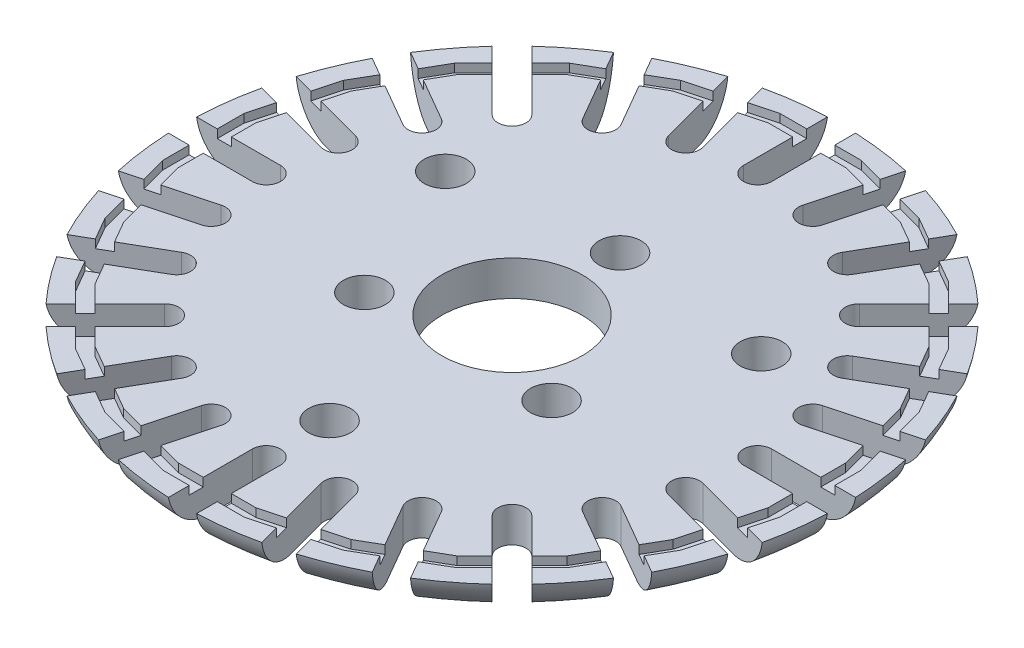
from build123d import *

# Parameters (mm, degrees)
ESBO_O1_R                = 23.5
RESSALTO_EXTRUS_O1_DEPTH = 2.5
FILETE1_R                = 3
CORTE_EXTRUS_O1_DEPTH    = 34.327916234
PADR_OCIRCULAR1_COUNT    = 24
CORTE_EXTRUS_O2_DEPTH    = 0.6
PADR_OCIRCULAR2_COUNT    = 24
ESBO_O5_R                = 5
CORTE_EXTRUS_O3_DEPTH    = 34.29789798
ESBO_O6_R                = 1.5
CORTE_EXTRUS_O5_DEPTH    = 2.5


with BuildPart() as part:
    # Esboço1 → Ressalto-extrusão1 (new body)
    with BuildSketch(Plane(origin=(0, 0, 0), x_dir=(1, 0, 0), z_dir=(0, 1, 0))):
        with Locations(Location((0, 0, 0), (0, 0, 270))):
            Circle(ESBO_O1_R)
    extrude(amount=RESSALTO_EXTRUS_O1_DEPTH)

    # Filete1
    # the kernel refuses this fillet: 3 mm, written as the material it takes off along each edge
    with BuildSketch(Plane(origin=(0, 0, 0), x_dir=(0, 0, 1), z_dir=(-1, 0, 0))) as filete1_piece_1:
        with BuildLine():
            CenterArc((20.541960108, 3), FILETE1_R, 270, 80.405931773)
            Line((20.541960108, 0), (20.541960108, -0.06))
            Line((20.541960108, -0.06), (23.5, -0.06))
            Line((23.5, -0.06), (23.56, 0))
            ThreePointArc((23.56, 0), (23.56, 1.25), (23.559160798, 2.49))
            Line((23.559160798, 2.49), (23.5, 2.5))
        make_face()
    revolve(axis=Axis((0, 0, 0), (0, 1, 0)), mode=Mode.SUBTRACT)

    # Esboço2 → Corte-extrusão1 (cut, through all)
    with BuildSketch(Plane(origin=(0, 2.5, 0), x_dir=(1, 0, 0), z_dir=(0, 1, 0))):
        with BuildLine():
            Line((1, 17.5), (1, 23.5))
            Line((1, 23.5), (-1, 23.5))
            Line((-1, 23.5), (-1, 17.5))
            ThreePointArc((-1, 17.5), (0, 16.5), (1, 17.5))
        make_face()
    corte_extrus_o1 = extrude(amount=-CORTE_EXTRUS_O1_DEPTH, mode=Mode.SUBTRACT)

    # PadrãoCircular1: Corte-extrusão1 ×24 about axis
    padr_ocircular1_axis = Axis((0, 0, 0), (0, 1, 0))
    for i in range(1, PADR_OCIRCULAR1_COUNT):
        add(corte_extrus_o1.rotate(padr_ocircular1_axis, i * 360 / PADR_OCIRCULAR1_COUNT), mode=Mode.SUBTRACT)

    # Esboço4 → Corte-extrusão2 (cut)
    with BuildSketch(Plane(origin=(0, 2.5, 0), x_dir=(1, 0, 0), z_dir=(0, 1, 0))):
        Polygon((-2.896354947, 22), (2.896354947, 22), (2.764702449, 21), (-2.764702449, 21), align=None)
    corte_extrus_o2 = extrude(amount=-CORTE_EXTRUS_O2_DEPTH, mode=Mode.SUBTRACT)

    # PadrãoCircular2: Corte-extrusão2 ×24 about axis
    padr_ocircular2_axis = Axis((0, 0, 0), (0, 1, 0))
    for i in range(1, PADR_OCIRCULAR2_COUNT):
        add(corte_extrus_o2.rotate(padr_ocircular2_axis, i * 360 / PADR_OCIRCULAR2_COUNT), mode=Mode.SUBTRACT)

    # Esboço5 → Corte-extrusão3 (cut, through all)
    with BuildSketch(Plane(origin=(0, 2.5, 0), x_dir=(1, 0, 0), z_dir=(0, 1, 0))):
        with Locations(Location((0, 0, 0), (0, 0, 270))):
            Circle(ESBO_O5_R)
    extrude(amount=-CORTE_EXTRUS_O3_DEPTH, mode=Mode.SUBTRACT)

    # Esboço6 → Corte-extrusão5 (cut)
    with BuildSketch(Plane(origin=(0, 2.5, 0), x_dir=(1, 0, 0), z_dir=(0, 1, 0))):
        with Locations(Location((0, 7.7, 0), (0, 0, 270))):
            Circle(ESBO_O6_R)
        with Locations(Location((-6.668395609, -3.85, 0), (0, 0, 270))):
            Circle(ESBO_O6_R)
        with Locations(Location((6.668395609, -3.85, 0), (0, 0, 270))):
            Circle(ESBO_O6_R)
        with Locations(Location((-11.258330249, 6.5, 0), (0, 0, 270))):
            Circle(ESBO_O6_R)
        with Locations(Location((11.258330249, 6.5, 0), (0, 0, 270))):
            Circle(ESBO_O6_R)
        with Locations(Location((0, -13, 0), (0, 0, 270))):
            Circle(ESBO_O6_R)
    extrude(amount=-CORTE_EXTRUS_O5_DEPTH, mode=Mode.SUBTRACT)


solid = part.part
